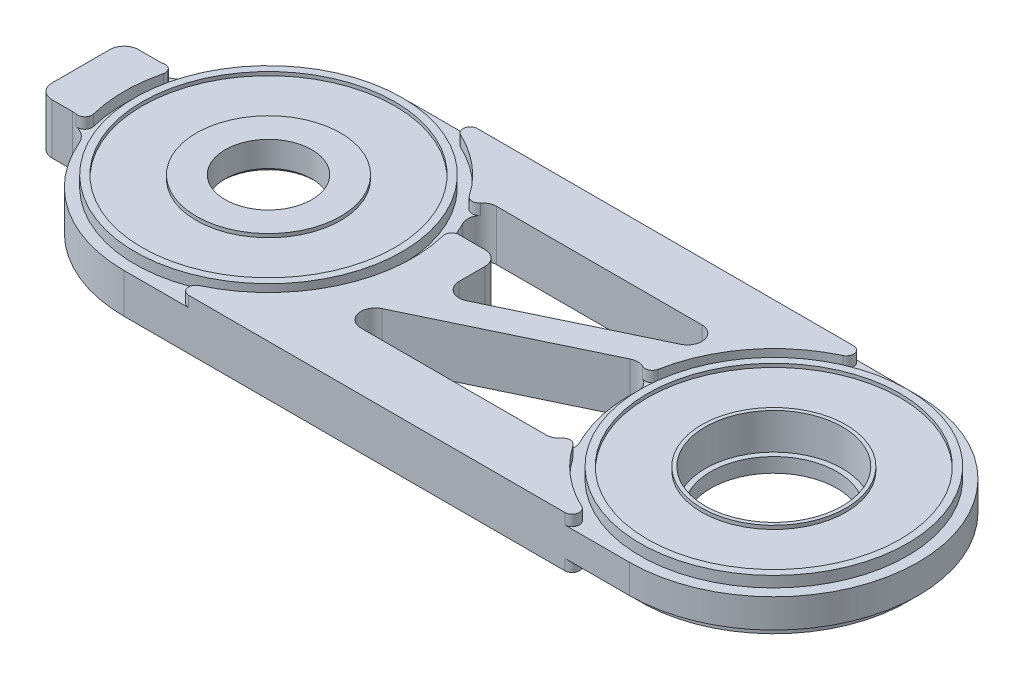
from build123d import *

# Parameters (mm, degrees)
BOSS_EXTRUDE1_DEPTH = 3.5
CUT_EXTRUDE1_DEPTH  = 65.575537164
SKETCH3_R           = 9.5
CUT_EXTRUDE2_DEPTH  = 5
SKETCH4_R           = 8.75
CUT_EXTRUDE3_DEPTH  = 65.389440128
SKETCH5_R           = 17.5
SKETCH5_R_2         = 10
CUT_EXTRUDE4_DEPTH  = 0.5
SKETCH6_W           = 1.5
SKETCH6_H           = 1.5
FILLET1_START       = 2
FILLET1_DEPTH       = 2
SKETCH7_R           = 6
CUT_EXTRUDE5_DEPTH  = 65.575537164
FILLET2_R           = 3
FILLET3_START       = 2
FILLET3_DEPTH       = 1.5
SKETCH8_R           = 11.25
CUT_EXTRUDE6_DEPTH  = 3
CHAMFER1_SIZE       = 0.5


with BuildPart() as part:
    # Sketch1 → Boss-Extrude1 (new, symmetric)
    with BuildSketch(Plane(origin=(0, 0, 0), x_dir=(1, 0, 0), z_dir=(0, 1, 0))):
        with BuildLine():
            Line((35, -20), (-35, -20))
            ThreePointArc((-35, -20), (-55, 0), (-35, 20))
            Line((-35, 20), (35, 20))
            ThreePointArc((35, 20), (55, 0), (35, -20))
        make_face()
        with BuildLine():
            ThreePointArc((-54.078784028, -6), (-55, 0), (-54.078784028, 6))
            Line((-54.078784028, 6), (-59, 6))
            ThreePointArc((-59, 6), (-60.414213562, 5.414213562), (-61, 4))
            Line((-61, 4), (-61, -4))
            ThreePointArc((-61, -4), (-60.414213562, -5.414213562), (-59, -6))
            Line((-59, -6), (-54.078784028, -6))
        make_face()
    extrude(amount=BOSS_EXTRUDE1_DEPTH, both=True)

    # Sketch2 → Cut-Extrude1 (cut, through all)
    with BuildSketch(Plane(origin=(0, 3.5, 0), x_dir=(1, 0, 0), z_dir=(0, 1, 0))):
        with BuildLine():
            Line((-9, 0.403045012), (-9, 4))
            ThreePointArc((-9, 4), (-9.585786438, 5.414213562), (-11, 6))
            Line((-11, 6), (-14.506098468, 6))
            ThreePointArc((-14.506098468, 6), (-15.634250618, 6.348554352), (-16.369180426, 7.272727273))
            ThreePointArc((-16.369180426, 7.272727273), (-16.754692523, 8.191993351), (-17.185529143, 9.090909091))
            ThreePointArc((-17.185529143, 9.090909091), (-17.109687789, 11.044465936), (-15.404082058, 12))
            Line((-15.404082058, 12), (13.028991175, 12))
            ThreePointArc((13.028991175, 12), (14.979283853, 10.443123537), (13.893211766, 8.196358469))
            Line((13.893211766, 8.196358469), (-6.135779409, -1.400596519))
            ThreePointArc((-6.135779409, -1.400596519), (-8.06572952, -1.289355825), (-9, 0.403045012))
        make_face()
        with BuildLine():
            Line((15.404082058, -12), (-10.197521624, -12))
            ThreePointArc((-10.197521624, -12), (-12.147814303, -10.443123537), (-11.061742215, -8.196358469))
            Line((-11.061742215, -8.196358469), (12.164770585, 2.932699201))
            ThreePointArc((12.164770585, 2.932699201), (14.137811537, 2.793544801), (15.026355614, 1.026416064))
            ThreePointArc((15.026355614, 1.026416064), (15.440463184, -4.174268742), (17.185529143, -9.090909091))
            ThreePointArc((17.185529143, -9.090909091), (17.109687789, -11.044465936), (15.404082058, -12))
        make_face()
    extrude(amount=-CUT_EXTRUDE1_DEPTH, mode=Mode.SUBTRACT)

    # Sketch3 → Cut-Extrude2 (cut)
    with BuildSketch(Plane(origin=(0, 3.5, 0), x_dir=(1, 0, 0), z_dir=(0, 1, 0))):
        with Locations(Location((35, 0, 0), (0, 0, 270))):
            Circle(SKETCH3_R)
    extrude(amount=-CUT_EXTRUDE2_DEPTH, mode=Mode.SUBTRACT)

    # Sketch4 → Cut-Extrude3 (cut, through all)
    with BuildSketch(Plane(origin=(0, -1.5, 0), x_dir=(1, 0, 0), z_dir=(0, 1, 0))):
        with Locations(Location((35, 0, 0), (0, 0, 270))):
            Circle(SKETCH4_R)
    extrude(amount=-CUT_EXTRUDE3_DEPTH, mode=Mode.SUBTRACT)

    # Sketch5 → Cut-Extrude4 (cut)
    with BuildSketch(Plane(origin=(0, 3.5, 0), x_dir=(1, 0, 0), z_dir=(0, 1, 0))):
        with Locations(Location((35, 0, 0), (0, 0, 270))):
            Circle(SKETCH5_R)
        with Locations(Location((35, 0, 0), (0, 0, 270))):
            Circle(SKETCH5_R_2, mode=Mode.SUBTRACT)
    cut_extrude4 = extrude(amount=-CUT_EXTRUDE4_DEPTH, mode=Mode.SUBTRACT)

    # Mirror1: Cut-Extrude4 across plane
    add(cut_extrude4.mirror(Plane.ZX), mode=Mode.SUBTRACT)

    # Sketch6 → Cut-Revolve1 (revolve, cut)
    with BuildSketch(Plane.XY, mode=Mode.PRIVATE) as cut_revolve1_sk:
        with Locations((54.25, 2.75)):
            Rectangle(SKETCH6_W, SKETCH6_H)
    cut_revolve1 = revolve(cut_revolve1_sk.sketch.rotate(Axis((35, -15.42459361, 0), (0, 1, 0)), 90), axis=Axis((35, -15.42459361, 0), (0, 1, 0)), mode=Mode.SUBTRACT)

    # Fillet1: read off the stored shape, not the designer's step
    # Fillet1 outline → Fillet1 (cut)
    with BuildSketch(Plane(origin=(0, 0, 0), x_dir=(1, 0, 0), z_dir=(0, 1, 0)).offset(FILLET1_START)):
        with BuildLine():
            ThreePointArc((35, -20), (30.635642195, -19.518001459), (26.4816458, -18.095238095))
            ThreePointArc((26.4816458, -18.095238095), (27.031628163, -19.21821789), (26.05572809, -20))
            Line((26.05572809, -20), (35, -20))
        make_face()
        with BuildLine():
            ThreePointArc((16.941442804, -11.27926617), (17.755344518, -10.919922264), (18.533450645, -11.351332624))
            ThreePointArc((18.533450645, -11.351332624), (17.82226833, -10.243316586), (17.185529143, -9.090909091))
            ThreePointArc((17.185529143, -9.090909091), (17.391756084, -10.221702427), (16.941442804, -11.27926617))
        make_face()
        with BuildLine():
            ThreePointArc((15.026355614, 1.026416064), (15.13716872, 2.338361293), (15.334061369, 3.640172766))
            ThreePointArc((15.334061369, 3.640172766), (14.799862167, 2.928698763), (13.91017335, 2.924473493))
            ThreePointArc((13.91017335, 2.924473493), (14.752987449, 2.142880559), (15.026355614, 1.026416064))
        make_face()
        with BuildLine():
            ThreePointArc((26.05572809, 20), (27.031628163, 19.21821789), (26.4816458, 18.095238095))
            ThreePointArc((26.4816458, 18.095238095), (30.635642195, 19.518001459), (35, 20))
            Line((35, 20), (26.05572809, 20))
        make_face()
    fillet1 = extrude(amount=FILLET1_DEPTH, mode=Mode.SUBTRACT)

    # Mirror2: Cut-Revolve1, Fillet1 across plane
    add(cut_revolve1.mirror(Plane.ZX), mode=Mode.SUBTRACT)
    add(fillet1.mirror(Plane.ZX), mode=Mode.SUBTRACT)

    # Sketch7 → Cut-Extrude5 (cut, through all)
    with BuildSketch(Plane.XZ.offset(3.5)):
        with Locations(Location((-35, 0, 0), (0, 0, 270))):
            Circle(SKETCH7_R)
    extrude(amount=-CUT_EXTRUDE5_DEPTH, mode=Mode.SUBTRACT)

    # Fillet2
    fillet2_edges = [part.edges().sort_by_distance(p)[0] for p in [
        (-54.078784028, 0, 6),
        (-54.078784028, 0, -6),
    ]]
    fillet(fillet2_edges, radius=FILLET2_R)

    # Mirror3: Cut-Extrude4, Cut-Revolve1 across plane
    add(cut_extrude4.mirror(Plane(origin=(0, 0, 0), x_dir=(0, 0, 1), z_dir=(1, 0, 0))), mode=Mode.SUBTRACT)
    add(cut_revolve1.mirror(Plane(origin=(0, 0, 0), x_dir=(0, 0, 1), z_dir=(1, 0, 0))), mode=Mode.SUBTRACT)

    # Fillet3: read off the stored shape, not the designer's step
    # Fillet3 outline → Fillet3 (cut)
    with BuildSketch(Plane(origin=(0, 0, 0), x_dir=(1, 0, 0), z_dir=(0, 1, 0)).offset(FILLET3_START)):
        with BuildLine():
            ThreePointArc((-53.405226512, -7.826086957), (-53.964760447, -6.351209427), (-54.40631736, -4.836821944))
            ThreePointArc((-54.40631736, -4.836821944), (-54.653584548, -5.769460122), (-55.573977543, -6.058997281))
            ThreePointArc((-55.573977543, -6.058997281), (-54.271017927, -6.67427362), (-53.405226512, -7.826086957))
        make_face()
        with BuildLine():
            ThreePointArc((-55.573977543, 6.058997281), (-54.653584548, 5.769460122), (-54.40631736, 4.836821944))
            ThreePointArc((-54.40631736, 4.836821944), (-53.964760447, 6.351209427), (-53.405226512, 7.826086957))
            ThreePointArc((-53.405226512, 7.826086957), (-54.271017927, 6.67427362), (-55.573977543, 6.058997281))
        make_face()
        with BuildLine():
            Line((-35, -20), (-26.05572809, -20))
            ThreePointArc((-26.05572809, -20), (-27.031628163, -19.21821789), (-26.4816458, -18.095238095))
            ThreePointArc((-26.4816458, -18.095238095), (-30.635642195, -19.518001459), (-35, -20))
        make_face()
        with BuildLine():
            ThreePointArc((-16.369180426, 7.272727273), (-15.93104029, 6.031150433), (-15.575539296, 4.7634364))
            ThreePointArc((-15.575539296, 4.7634364), (-15.380926528, 5.631589563), (-14.571576996, 6.001072147))
            ThreePointArc((-14.571576996, 6.001072147), (-15.661136596, 6.367245602), (-16.369180426, 7.272727273))
        make_face()
        with BuildLine():
            ThreePointArc((-17.185529143, 9.090909091), (-17.391756084, 10.221702427), (-16.941442805, 11.279266171))
            ThreePointArc((-16.941442805, 11.279266171), (-17.755344518, 10.919922264), (-18.533450645, 11.351332624))
            ThreePointArc((-18.533450645, 11.351332624), (-17.82226833, 10.243316586), (-17.185529143, 9.090909091))
        make_face()
        with BuildLine():
            ThreePointArc((-35, 20), (-30.635642195, 19.518001459), (-26.4816458, 18.095238095))
            ThreePointArc((-26.4816458, 18.095238095), (-27.031628163, 19.21821789), (-26.05572809, 20))
            Line((-26.05572809, 20), (-35, 20))
        make_face()
    extrude(amount=FILLET3_DEPTH, mode=Mode.SUBTRACT)

    # Sketch8 → Cut-Extrude6 (cut)
    with BuildSketch(Plane.XZ.offset(3.5)):
        with Locations(Location((-35, 0, 0), (0, 0, 270))):
            Circle(SKETCH8_R)
    extrude(amount=-CUT_EXTRUDE6_DEPTH, mode=Mode.SUBTRACT)

    # Chamfer1
    chamfer1_edges = [part.edges().sort_by_distance(p)[0] for p in [
        (-35, -0.5, 6),
    ]]
    chamfer(chamfer1_edges, length=CHAMFER1_SIZE)


solid = part.part
